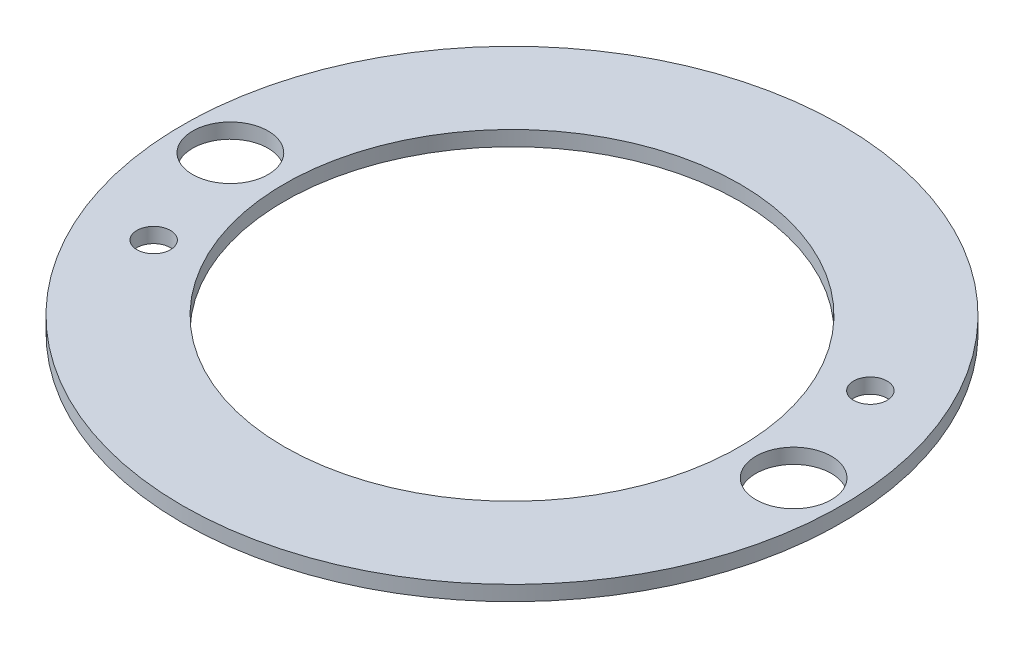
from build123d import *

# Parameters (mm, degrees)
SKETCH1_R           = 69.85
BOSS_EXTRUDE1_DEPTH = 3.175
SKETCH2_R           = 8.001
SKETCH2_R_2         = 3.556
CUT_EXTRUDE1_DEPTH  = 3.175
SKETCH3_R           = 48.26
CUT_EXTRUDE2_DEPTH  = 3.175


with BuildPart() as part:
    # Sketch1 → Boss-Extrude1 (new body)
    with BuildSketch(Plane(origin=(0, 0, 0), x_dir=(1, 0, 0), z_dir=(0, 1, 0))):
        Circle(SKETCH1_R)
    extrude(amount=BOSS_EXTRUDE1_DEPTH)

    # Sketch2 → Cut-Extrude1 (cut)
    with BuildSketch(Plane(origin=(0, 3.175, 0), x_dir=(1, 0, 0), z_dir=(0, 1, 0))):
        with Locations((-59.69, 0)):
            Circle(SKETCH2_R)
        with Locations((59.69, 0)):
            Circle(SKETCH2_R)
        with Locations((-51.795490029, -24.152633658)):
            Circle(SKETCH2_R_2)
        with Locations((51.795490029, 24.152633658)):
            Circle(SKETCH2_R_2)
    extrude(amount=-CUT_EXTRUDE1_DEPTH, mode=Mode.SUBTRACT)

    # Sketch3 → Cut-Extrude2 (cut)
    with BuildSketch(Plane(origin=(0, 3.175, 0), x_dir=(1, 0, 0), z_dir=(0, 1, 0))):
        Circle(SKETCH3_R)
    extrude(amount=-CUT_EXTRUDE2_DEPTH, mode=Mode.SUBTRACT)


solid = part.part
